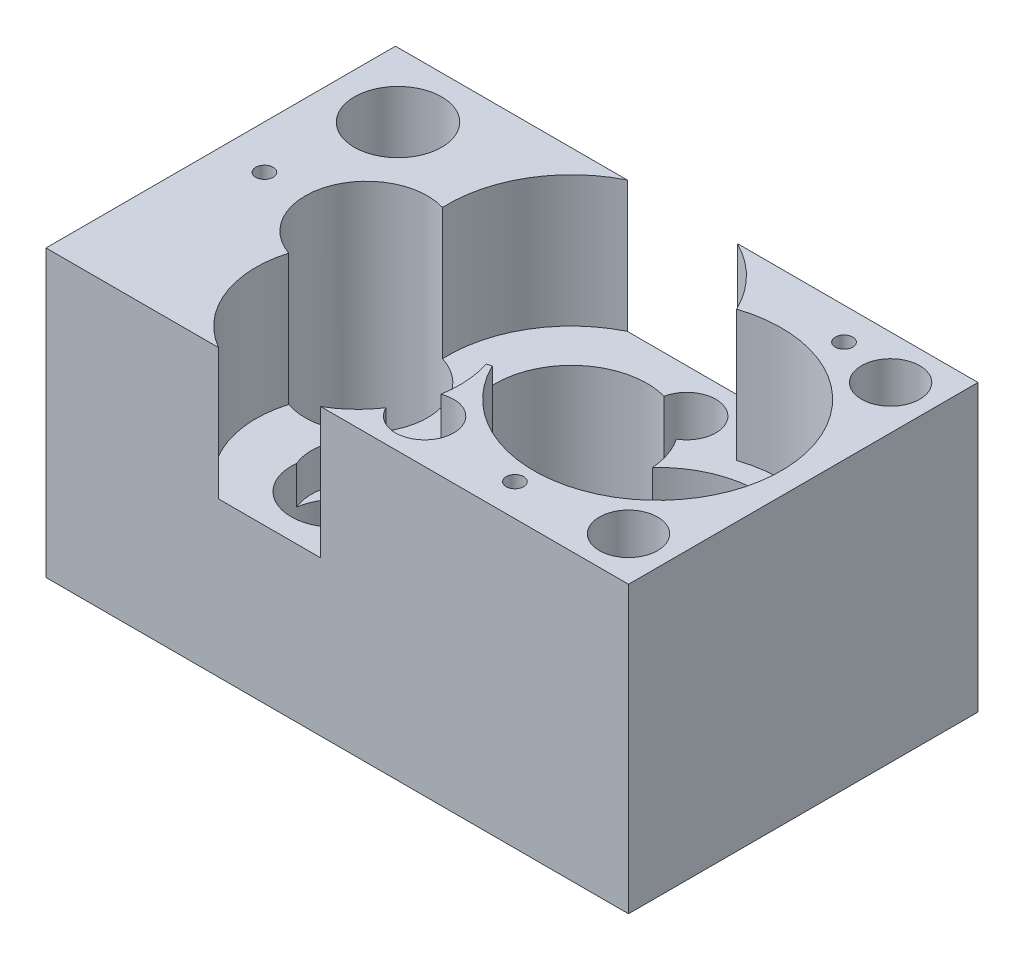
from build123d import *

# Parameters (mm, degrees)
SKETCH_1_W          = 20
SKETCH_1_H          = 12
SKETCH_1_R          = 1.6
SKETCH_1_R_2        = 2.1
EXTRUDE_1_DEPTH     = 5.3
EXTRUDE_2_DEPTH     = 1.5
SKETCH_1_5_R        = 1.6
EXTRUDE_3_DEPTH     = 4
EXTRUDE_START       = 5.3
EXTRUDE_4_DEPTH     = 4.5
SKETCH_2_R          = 0.9
SKETCH_2_R_2        = 0.7
CUT_EXTRUDE_1_DEPTH = 26.299011838
CUT_EXTRUDE_START   = 9.8
SKETCH_2_3_R        = 1.5
CUT_EXTRUDE_2_DEPTH = 8.8
SKETCH_2_4_R        = 1
CUT_EXTRUDE_3_DEPTH = 7.8
SKETCH_2_5_R        = 0.3
CUT_EXTRUDE_4_DEPTH = 6


with BuildPart() as part:
    # 草图1 → 凸台-拉伸1 (new body)
    with BuildSketch(Plane(origin=(0, 0, 0), x_dir=(1, 0, 0), z_dir=(0, 1, 0))):
        with Locations((10, -6)):
            Rectangle(SKETCH_1_W, SKETCH_1_H)
        with BuildLine():
            ThreePointArc((12.439835428, -3.613463312), (18.220575086, -7.370363498), (11.50515478, -5.81011348))
            ThreePointArc((11.50515478, -5.81011348), (7.454652656, -2.789434091), (12.439835428, -3.613463312))
        make_face(mode=Mode.SUBTRACT)
        with Locations(Location((7.678736094, -8.970584613, 0), (0, 0, 270))):
            Circle(SKETCH_1_R, mode=Mode.SUBTRACT)
        with Locations(Location((5, -6, 0), (0, 0, 270))):
            Circle(SKETCH_1_R_2, mode=Mode.SUBTRACT)
    extrude(amount=EXTRUDE_1_DEPTH)

    # 草图1<4> → 凸台-拉伸2 (add)
    with BuildSketch(Plane(origin=(0, 0, 0), x_dir=(1, 0, 0), z_dir=(0, 1, 0))):
        with BuildLine():
            ThreePointArc((11.50515478, -5.81011348), (11.779424914, -4.629636502), (12.439835428, -3.613463312))
            ThreePointArc((12.439835428, -3.613463312), (7.454652656, -2.789434091), (11.50515478, -5.81011348))
        make_face()
    extrude(amount=EXTRUDE_2_DEPTH)

    # 草图1<5> → 凸台-拉伸3 (add)
    with BuildSketch(Plane(origin=(0, 0, 0), x_dir=(1, 0, 0), z_dir=(0, 1, 0))):
        with Locations(Location((7.678736094, -8.970584613, 0), (0, 0, 270))):
            Circle(SKETCH_1_5_R)
    extrude(amount=EXTRUDE_3_DEPTH)

    # 草图1<6> → 凸台-拉伸4 (add)
    with BuildSketch(Plane(origin=(0, 0, 0), x_dir=(1, 0, 0), z_dir=(0, 1, 0)).offset(EXTRUDE_START)):
        with BuildLine():
            Line((7.958677072, 0), (0, 0))
            Line((0, 0), (0, -12))
            Line((0, -12), (5.925840657, -12))
            ThreePointArc((5.925840657, -12), (4.429268792, -10.270954659), (4.319841502, -7.986802561))
            ThreePointArc((4.319841502, -7.986802561), (3.000111311, -5.359340003), (5.600909971, -3.987810345))
            ThreePointArc((5.600909971, -3.987810345), (6.188678117, -1.644412009), (7.958677072, 0))
        make_face()
        with BuildLine():
            Line((20, 0), (11.735482653, 0))
            ThreePointArc((11.735482653, 0), (12.869036074, -0.819060885), (13.675372646, -1.961700559))
            ThreePointArc((13.675372646, -1.961700559), (18.910698319, -7.664012819), (11.171707216, -7.845717845))
            ThreePointArc((11.171707216, -7.845717845), (11.090844977, -7.871351024), (11.009487245, -7.895365208))
            ThreePointArc((11.009487245, -7.895365208), (10.945672327, -10.226422042), (9.43163153, -12))
            Line((9.43163153, -12), (20, -12))
            Line((20, -12), (20, 0))
        make_face()
    extrude(amount=EXTRUDE_4_DEPTH)

    # 草图2 → 切除-拉伸1 (cut, through all)
    with BuildSketch(Plane(origin=(0, 0, 0), x_dir=(1, 0, 0), z_dir=(0, 1, 0))):
        with Locations(Location((2.3, -2.214171161, 0), (0, 0, 270))):
            Circle(SKETCH_2_R)
        with Locations(Location((7.7, -9.785828839, 0), (0, 0, 313.840961576))):
            Circle(SKETCH_2_R)
        with Locations(Location((11.5, -1.5, 0), (0, 0, 171.097944201))):
            Circle(SKETCH_2_R_2)
        with Locations(Location((18.5, -10.5, 0), (0, 0, 270))):
            Circle(SKETCH_2_R_2)
        with Locations(Location((18.5, -1.5, 0), (0, 0, 270))):
            Circle(SKETCH_2_R_2)
        with Locations(Location((11.5, -10.5, 0), (0, 0, 132.232284036))):
            Circle(SKETCH_2_R_2)
    extrude(amount=CUT_EXTRUDE_1_DEPTH, mode=Mode.SUBTRACT)

    # 草图2<3> → 切除-拉伸2 (cut)
    with BuildSketch(Plane(origin=(0, 0, 0), x_dir=(1, 0, 0), z_dir=(0, 1, 0)).offset(CUT_EXTRUDE_START)):
        with Locations(Location((2.3, -2.214171161, 0), (0, 0, 270))):
            Circle(SKETCH_2_3_R)
        with Locations(Location((7.7, -9.785828839, 0), (0, 0, 270))):
            Circle(SKETCH_2_3_R)
    extrude(amount=-CUT_EXTRUDE_2_DEPTH, mode=Mode.SUBTRACT)

    # 草图2<4> → 切除-拉伸3 (cut)
    with BuildSketch(Plane(origin=(0, 0, 0), x_dir=(1, 0, 0), z_dir=(0, 1, 0)).offset(CUT_EXTRUDE_START)):
        with Locations((11.5, -1.5)):
            Circle(SKETCH_2_4_R)
        with Locations(Location((18.5, -10.5, 0), (0, 0, 270))):
            Circle(SKETCH_2_4_R)
        with Locations(Location((18.5, -1.5, 0), (0, 0, 270))):
            Circle(SKETCH_2_4_R)
        with Locations(Location((11.5, -10.5, 0), (0, 0, 270))):
            Circle(SKETCH_2_4_R)
    extrude(amount=-CUT_EXTRUDE_3_DEPTH, mode=Mode.SUBTRACT)

    # 草图2<5> → 切除-拉伸4 (cut)
    with BuildSketch(Plane(origin=(0, 0, 0), x_dir=(1, 0, 0), z_dir=(0, 1, 0)).offset(CUT_EXTRUDE_START)):
        with Locations(Location((1.5, -6, 0), (0, 0, 270))):
            Circle(SKETCH_2_5_R)
        with Locations(Location((16.5, -1.1, 0), (0, 0, 270))):
            Circle(SKETCH_2_5_R)
        with Locations(Location((15, -10.9, 0), (0, 0, 270))):
            Circle(SKETCH_2_5_R)
    extrude(amount=-CUT_EXTRUDE_4_DEPTH, mode=Mode.SUBTRACT)


solid = part.part
